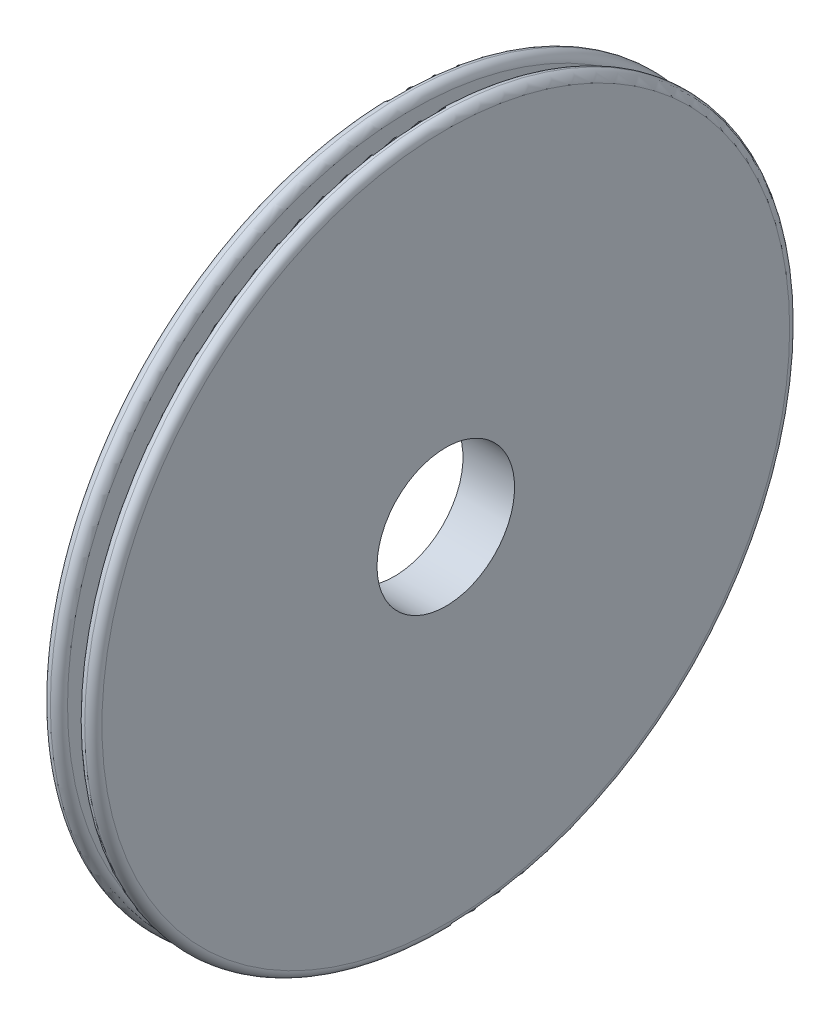
from build123d import *

# Parameters (mm, degrees)
CONG_1_R = 1


with BuildPart() as part:
    # Esquisse1 → Révolution2 (revolve)
    with BuildSketch(Plane.XY, mode=Mode.PRIVATE) as r_volution2_sk:
        Polygon((-1, 36), (1, 36), (1, 41), (3, 41), (3, 8), (-3, 8), (-3, 41), (-1, 41), align=None)
    revolve(r_volution2_sk.sketch.rotate(Axis((0, 0, 0), (1, 0, 0)), 90), axis=Axis((0, 0, 0), (1, 0, 0)))

    # Congé1
    cong_1_edges = [part.edges().sort_by_distance(p)[0] for p in [
        (-3, 0, -41),
        (-1, 0, -41),
        (1, 0, -41),
        (3, 0, -41),
    ]]
    fillet(cong_1_edges, radius=CONG_1_R - 0.0001)  # a hair under: the kernel refuses the full size


solid = part.part
